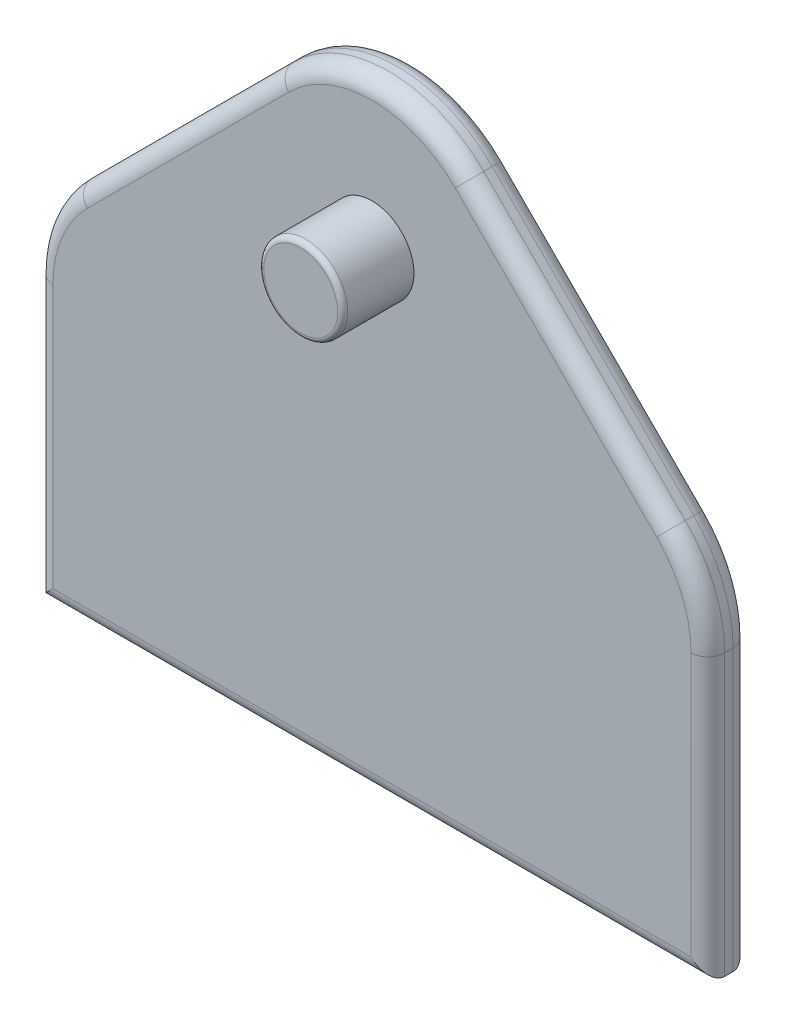
from build123d import *

# Parameters (mm, degrees)
BOSS_EXTRUDE1_DEPTH = 6.35
FILLET1_R           = 2.54
FILLET2_R           = 2.54
FILLET3_R           = 20.32
SKETCH3_R           = 6.35
BOSS_EXTRUDE2_DEPTH = 10.795
FILLET5_R           = 0.762
BOSS_EXTRUDE3_DEPTH = 3.81


with BuildPart() as part:
    # Sketch1 → Boss-Extrude1 (new body)
    with BuildSketch(Plane.XY):
        Polygon((-50.8, 0), (50.8, 0), (50.8, 50.8), (0, 101.6), (-50.8, 50.8), align=None)
    extrude(amount=BOSS_EXTRUDE1_DEPTH)

    # Fillet1
    fillet1_edges = [part.edges().sort_by_distance(p)[0] for p in [
        (50.8, 25.4, 6.35),
        (25.4, 76.2, 6.35),
        (-25.4, 76.2, 6.35),
        (-50.8, 25.4, 6.35),
        (0, 0, 6.35),
    ]]
    fillet(fillet1_edges, radius=FILLET1_R)

    # Fillet2
    fillet2_edges = [part.edges().sort_by_distance(p)[0] for p in [
        (-25.4, 76.2, 0),
        (25.4, 76.2, 0),
        (50.8, 25.4, 0),
        (0, 0, 0),
        (-50.8, 25.4, 0),
    ]]
    fillet(fillet2_edges, radius=FILLET2_R)

    # Fillet3
    # the kernel refuses this fillet: 20.32 mm, written as the material it takes off along each edge
    with BuildSketch(Plane(origin=(30.48, 42.383180413, 6.35), x_dir=(1, 0, 0), z_dir=(0, -1, 0))) as fillet3_piece_1:
        with BuildLine():
            CenterArc((17.78, -2.54), 2.54, 0, 90)
            Line((20.32, -2.54), (20.32, 0))
            Line((20.32, 0), (17.78, 0))
        make_face()
    revolve(axis=Axis((30.48, 42.383180413, 6.35), (0, 0, 1)), revolution_arc=45, mode=Mode.SUBTRACT)
    with BuildSketch(Plane(origin=(0, 72.863180413, 6.35), x_dir=(0.7071067811865475, 0.7071067811865477, 0), z_dir=(0.7071067811865477, -0.7071067811865475, 0))) as fillet3_piece_2:
        with BuildLine():
            CenterArc((17.78, -2.54), 2.54, 0, 90)
            Line((20.32, -2.54), (20.32, 0))
            Line((20.32, 0), (17.78, 0))
        make_face()
    revolve(axis=Axis((0, 72.863180413, 6.35), (0, 0, 1)), revolution_arc=90, mode=Mode.SUBTRACT)
    with BuildSketch(Plane(origin=(-30.48, 42.383180413, 6.35), x_dir=(-0.7071067811865475, 0.7071067811865476, 0), z_dir=(0.7071067811865476, 0.7071067811865475, 0))) as fillet3_piece_3:
        with BuildLine():
            CenterArc((17.78, -2.54), 2.54, 0, 90)
            Line((20.32, -2.54), (20.32, 0))
            Line((20.32, 0), (17.78, 0))
        make_face()
    revolve(axis=Axis((-30.48, 42.383180413, 6.35), (0, 0, 1)), revolution_arc=45, mode=Mode.SUBTRACT)
    with BuildSketch(Plane(origin=(30.48, 42.383180413, 0), x_dir=(0.7071067811865475, 0.7071067811865477, 0), z_dir=(-0.7071067811865477, 0.7071067811865475, 0))) as fillet3_piece_4:
        with BuildLine():
            CenterArc((17.78, -2.54), 2.54, 0, 90)
            Line((20.32, -2.54), (20.32, 0))
            Line((20.32, 0), (17.78, 0))
        make_face()
    revolve(axis=Axis((30.48, 42.383180413, 0), (0, 0, -1)), revolution_arc=45, mode=Mode.SUBTRACT)
    with BuildSketch(Plane(origin=(0, 72.863180413, 0), x_dir=(-0.7071067811865475, 0.7071067811865476, 0), z_dir=(-0.7071067811865476, -0.7071067811865475, 0))) as fillet3_piece_5:
        with BuildLine():
            CenterArc((17.78, -2.54), 2.54, 0, 90)
            Line((20.32, -2.54), (20.32, 0))
            Line((20.32, 0), (17.78, 0))
        make_face()
    revolve(axis=Axis((0, 72.863180413, 0), (0, 0, -1)), revolution_arc=90, mode=Mode.SUBTRACT)
    with BuildSketch(Plane(origin=(-30.48, 42.383180413, 0), x_dir=(-1, 0, 0), z_dir=(0, -1, 0))) as fillet3_piece_6:
        with BuildLine():
            CenterArc((17.78, -2.54), 2.54, 0, 90)
            Line((20.32, -2.54), (20.32, 0))
            Line((20.32, 0), (17.78, 0))
        make_face()
    revolve(axis=Axis((-30.48, 42.383180413, 0), (0, 0, -1)), revolution_arc=45, mode=Mode.SUBTRACT)
    with BuildSketch(Plane(origin=(-50.8, 50.8, 0), x_dir=(0, -1, 0), z_dir=(0, 0, 1))) as fillet3_piece_7:
        with BuildLine():
            CenterArc((FILLET3_R * 0.414213562373, FILLET3_R), FILLET3_R, 225, 45)
            Line((-FILLET3_R * 0.292893218813, FILLET3_R * 0.292893218813), (0, 0))
            Line((0, 0), (FILLET3_R * 0.414213562373, 0))
        make_face()
    extrude(amount=6.35, mode=Mode.SUBTRACT)
    with BuildSketch(Plane(origin=(50.8, 50.8, 0), x_dir=(0, -1, 0), z_dir=(0, 0, 1))) as fillet3_piece_8:
        with BuildLine():
            CenterArc((FILLET3_R * 0.414213562373, -FILLET3_R), FILLET3_R, 90, 45)
            Line((-FILLET3_R * 0.292893218813, -FILLET3_R * 0.292893218813), (0, 0))
            Line((0, 0), (FILLET3_R * 0.414213562373, 0))
        make_face()
    extrude(amount=6.35, mode=Mode.SUBTRACT)
    with BuildSketch(Plane(origin=(0, 101.6, 0), x_dir=(-0.7071067811865476, -0.7071067811865476, 0), z_dir=(0, 0, 1))) as fillet3_piece_9:
        with BuildLine():
            CenterArc((FILLET3_R, FILLET3_R), FILLET3_R, 180, 90)
            Line((0, FILLET3_R), (0, 0))
            Line((0, 0), (FILLET3_R, 0))
        make_face()
    extrude(amount=6.35, mode=Mode.SUBTRACT)

    # Sketch3 → Boss-Extrude2 (add, symmetric)
    with BuildSketch(Plane.XY.offset(6.35)):
        with Locations((0, 71.12)):
            Circle(SKETCH3_R)
    extrude(amount=BOSS_EXTRUDE2_DEPTH, both=True)

    # Fillet5
    fillet5_edges = [part.edges().sort_by_distance(p)[0] for p in [
        (-6.35, 71.12, -4.445),
        (-6.35, 71.12, 17.145),
    ]]
    fillet(fillet5_edges, radius=FILLET5_R)

    # Sketch4 → Boss-Extrude3 (add)
    with BuildSketch(Plane(origin=(0, 0, 0), x_dir=(-1, 0, 0), z_dir=(0, 0, -1))):
        with BuildLine():
            Line((-38.1, 12.7), (38.1, 12.7))
            ThreePointArc((38.1, 12.7), (0, 50.8), (-38.1, 12.7))
        make_face()
    extrude(amount=BOSS_EXTRUDE3_DEPTH)


solid = part.part
